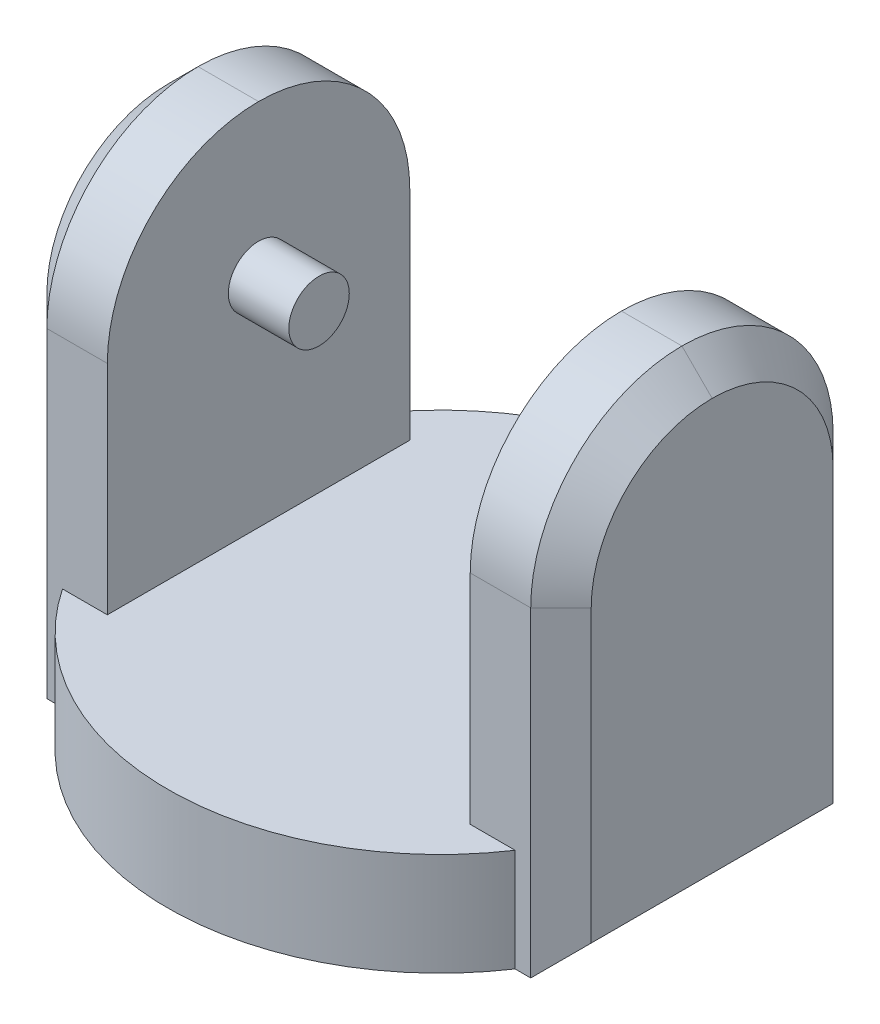
from build123d import *

# Parameters (mm, degrees)
SKETCH1_R           = 45
BOSS_EXTRUDE1_DEPTH = 17
SKETCH2_W           = 50
SKETCH2_H           = 78
BOSS_EXTRUDE2_DEPTH = 15
SKETCH3_W           = 50
SKETCH3_H           = 78
BOSS_EXTRUDE3_DEPTH = 15
FILLET1_R           = 25
CHAMFER1_SIZE       = 5
SKETCH4_R           = 5
BOSS_EXTRUDE4_DEPTH = 10
SKETCH5_R           = 5
CUT_EXTRUDE1_DEPTH  = 10


# Some blends are built 0.0001 mm under size
with BuildPart() as part:
    # Sketch1 → Boss-Extrude1 (new body)
    with BuildSketch(Plane(origin=(0, 0, 0), x_dir=(1, 0, 0), z_dir=(0, 1, 0))):
        with Locations(Location((0, 0, 0), (0, 0, 270))):
            Circle(SKETCH1_R)
    extrude(amount=BOSS_EXTRUDE1_DEPTH)

    # Sketch2 → Boss-Extrude2 (add)
    with BuildSketch(Plane(origin=(45, 0, 0), x_dir=(0, 0, -1), z_dir=(1, 0, 0))):
        with Locations((0, 39)):
            Rectangle(SKETCH2_W, SKETCH2_H)
    extrude(amount=-BOSS_EXTRUDE2_DEPTH)

    # Sketch3 → Boss-Extrude3 (add)
    with BuildSketch(Plane(origin=(-45, 0, 0), x_dir=(0, 0, -1), z_dir=(1, 0, 0))):
        with Locations((0, 39)):
            Rectangle(SKETCH3_W, SKETCH3_H)
    extrude(amount=BOSS_EXTRUDE3_DEPTH)

    # Fillet1
    fillet1_edges = [part.edges().sort_by_distance(p)[0] for p in [
        (37.5, 78, -25),
        (37.5, 78, 25),
        (-37.5, 78, 25),
        (-37.5, 78, -25),
    ]]
    fillet(fillet1_edges, radius=FILLET1_R - 0.0001)  # a hair under: the kernel refuses the full size

    # Chamfer1
    # the kernel refuses this chamfer: 5 mm, written as the material it takes off along each edge
    with BuildSketch(Plane(origin=(45, 0, 5.6e-08), x_dir=(-0.9996219169112968, -0.027495876610585467, 0), z_dir=(0, 0, -1))) as chamfer1_piece_1:
        Polygon((CHAMFER1_SIZE * 0.999621916911, CHAMFER1_SIZE * 0.0274958766106), (-CHAMFER1_SIZE * 0.0274958766106, CHAMFER1_SIZE * 0.999621916911), (0, 0), align=None)
    chamfer1_piece_1_solid = extrude(amount=37.858414995, mode=Mode.PRIVATE)
    with BuildSketch(Plane(origin=(45, -12.85841494, -25), x_dir=(-0.9996219169112968, 0, -0.027495876610586317), z_dir=(0, 1, 0)), Plane(origin=(45, 53.0001, 25), x_dir=(-0.9996219169112968, 0, 0.027495876610586317), z_dir=(0, -1, 0)), Plane(origin=(-45, 53.0001, 25), x_dir=(-0.027495876610586317, 0, -0.9996219169112968), z_dir=(0, -1, 0))) as chamfer1_piece_2:
        Polygon((CHAMFER1_SIZE * 0.999621916911, CHAMFER1_SIZE * 0.0274958766106), (-CHAMFER1_SIZE * 0.0274958766106, CHAMFER1_SIZE * 0.999621916911), (0, 0), align=None)
    chamfer1_piece_2_solid = extrude(amount=65.85851494, mode=Mode.PRIVATE)
    with BuildSketch(Plane(origin=(-45, 0, 37.85841494), x_dir=(-0.027495876610586317, 0.9996219169112968, 0), z_dir=(0, 0, -1))) as chamfer1_piece_3:
        Polygon((CHAMFER1_SIZE * 0.999621916911, CHAMFER1_SIZE * 0.0274958766106), (-CHAMFER1_SIZE * 0.0274958766106, CHAMFER1_SIZE * 0.999621916911), (0, 0), align=None)
    chamfer1_piece_3_solid = extrude(amount=37.85841513, mode=Mode.PRIVATE)
    with BuildSketch(Plane(origin=(-45, -12.85841494, -25), x_dir=(0.9996219169112968, 0, -0.027495876610586317), z_dir=(0, 1, 0))) as chamfer1_piece_4:
        Polygon((CHAMFER1_SIZE * 0.999621916911, -CHAMFER1_SIZE * 0.0274958766106), (-CHAMFER1_SIZE * 0.0274958766106, -CHAMFER1_SIZE * 0.999621916911), (0, 0), align=None)
    chamfer1_piece_4_solid = extrude(amount=65.85851494, mode=Mode.PRIVATE)
    with BuildSketch(Plane(origin=(45, 53.0001, 0.0001), x_dir=(0, 0, 1), z_dir=(0, -1, 0))) as chamfer1_piece_5:
        Polygon((24.9999 - CHAMFER1_SIZE, 0), (24.9999, CHAMFER1_SIZE), (24.9999, 0), align=None)
    chamfer1_piece_5_solid = revolve(axis=Axis((45, 53.0001, 0.0001), (-1, 0, 0)), revolution_arc=90, mode=Mode.PRIVATE)
    with BuildSketch(Plane(origin=(45, 53.0001, -0.0001), x_dir=(0, 0, -1), z_dir=(0, -1, 0))) as chamfer1_piece_6:
        Polygon((24.9999 - CHAMFER1_SIZE, 0), (24.9999, -CHAMFER1_SIZE), (24.9999, 0), align=None)
    chamfer1_piece_6_solid = revolve(axis=Axis((45, 53.0001, -0.0001), (1, 0, 0)), revolution_arc=90, mode=Mode.PRIVATE)
    with BuildSketch(Plane(origin=(-45, 53.0001, -0.0001), x_dir=(0, 0, -1), z_dir=(0, -1, 0))) as chamfer1_piece_7:
        Polygon((24.9999 - CHAMFER1_SIZE, 0), (24.9999, CHAMFER1_SIZE), (24.9999, 0), align=None)
    chamfer1_piece_7_solid = revolve(axis=Axis((-45, 53.0001, -0.0001), (1, 0, 0)), revolution_arc=90, mode=Mode.PRIVATE)
    with BuildSketch(Plane(origin=(-45, 53.0001, 0.0001), x_dir=(0, 1, 0), z_dir=(0, 0, -1))) as chamfer1_piece_8:
        Polygon((24.9999 - CHAMFER1_SIZE, 0), (24.9999, CHAMFER1_SIZE), (24.9999, 0), align=None)
    chamfer1_piece_8_solid = revolve(axis=Axis((-45, 53.0001, 0.0001), (1, 0, 0)), revolution_arc=90, mode=Mode.PRIVATE)
    with BuildSketch(Plane(origin=(-45, 78, -0.0001), x_dir=(-0.027495876610586282, -0.9996219169112968, 0), z_dir=(0, 0, 1))) as chamfer1_piece_9:
        Polygon((CHAMFER1_SIZE * 0.999621916911, CHAMFER1_SIZE * 0.0274958766106), (-CHAMFER1_SIZE * 0.0274958766106, CHAMFER1_SIZE * 0.999621916911), (0, 0), align=None)
    chamfer1_piece_9_solid = extrude(amount=0.0002, mode=Mode.PRIVATE)
    with BuildSketch(Plane(origin=(45, 78, -0.0001), x_dir=(0.027495876610586282, -0.9996219169112968, 0), z_dir=(0, 0, 1))) as chamfer1_piece_10:
        Polygon((CHAMFER1_SIZE * 0.999621916911, -CHAMFER1_SIZE * 0.0274958766106), (-CHAMFER1_SIZE * 0.0274958766106, -CHAMFER1_SIZE * 0.999621916911), (0, 0), align=None)
    chamfer1_piece_10_solid = extrude(amount=0.0002, mode=Mode.PRIVATE)
    with BuildSketch(Plane(origin=(-45, 0, -1.91e-07), x_dir=(-0.027495876610586334, 0.9996219169112968, 0), z_dir=(0, 0, -1))) as chamfer1_piece_11:
        Polygon((CHAMFER1_SIZE * 0.999621916911, CHAMFER1_SIZE * 0.0274958766106), (-CHAMFER1_SIZE * 0.0274958766106, CHAMFER1_SIZE * 0.999621916911), (0, 0), align=None)
    chamfer1_piece_11_solid = extrude(amount=37.858414749, mode=Mode.PRIVATE)
    with BuildSketch(Plane(origin=(45, 0, 37.85841494), x_dir=(-0.9996219169112968, -0.027495876610586372, 0), z_dir=(0, 0, -1))) as chamfer1_piece_12:
        Polygon((CHAMFER1_SIZE * 0.999621916911, CHAMFER1_SIZE * 0.0274958766106), (-CHAMFER1_SIZE * 0.0274958766106, CHAMFER1_SIZE * 0.999621916911), (0, 0), align=None)
    chamfer1_piece_12_solid = extrude(amount=37.858414884, mode=Mode.PRIVATE)
    add([chamfer1_piece_1_solid, chamfer1_piece_2_solid, chamfer1_piece_3_solid, chamfer1_piece_4_solid, chamfer1_piece_5_solid, chamfer1_piece_6_solid, chamfer1_piece_7_solid, chamfer1_piece_8_solid, chamfer1_piece_9_solid, chamfer1_piece_10_solid, chamfer1_piece_11_solid, chamfer1_piece_12_solid], mode=Mode.SUBTRACT)

    # Sketch4 → Boss-Extrude4 (add)
    with BuildSketch(Plane(origin=(-30, 0, 0), x_dir=(0, 0, -1), z_dir=(1, 0, 0))):
        with Locations(Location((0, 53, 0), (0, 0, 180))):
            Circle(SKETCH4_R)
    extrude(amount=BOSS_EXTRUDE4_DEPTH)

    # Sketch5 → Cut-Extrude1 (cut)
    with BuildSketch(Plane(origin=(0, 0, 0), x_dir=(-1, 0, 0), z_dir=(0, -1, 0))):
        with Locations(Location((0, 0, 0), (0, 0, 90))):
            Circle(SKETCH5_R)
    extrude(amount=-CUT_EXTRUDE1_DEPTH, mode=Mode.SUBTRACT)


solid = part.part
